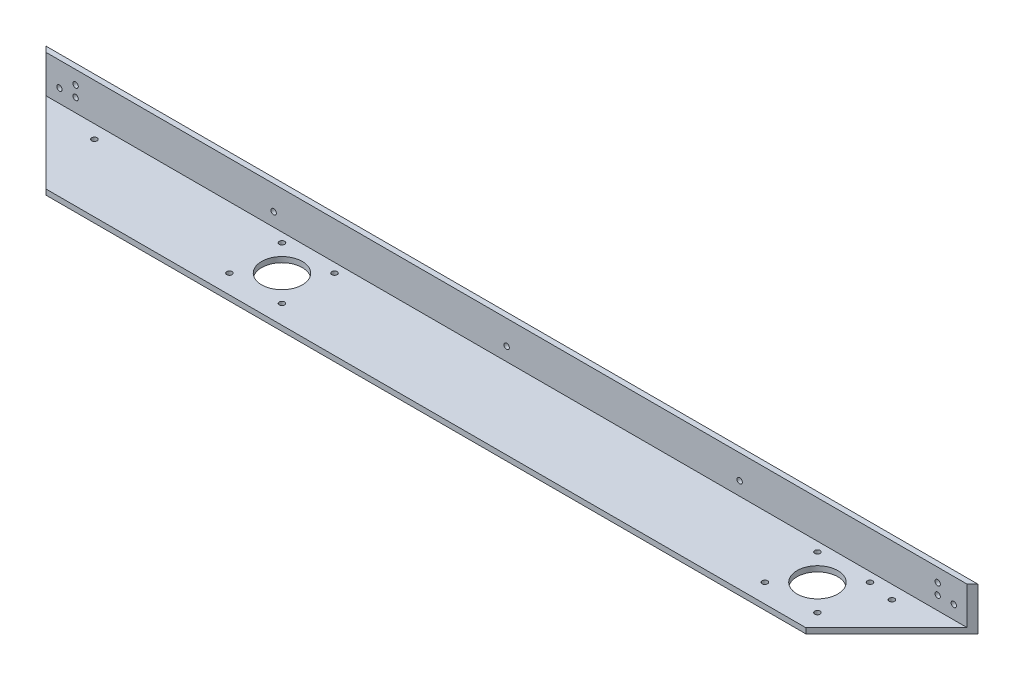
from build123d import *

# Parameters (mm, degrees)
BOSS_EXTRUDE1_DEPTH               = 550
CHAMFER7_SIZE                     = 50.8
CHAMFER8_SIZE                     = 50.8
BOTTHOMHOLES_SKETCH2_R            = 12
BOTTHOMHOLES_SKETCH2_R_2          = 1.5875
BOTTOMHOLES_CUT_EXTRUDE1_DEPTH    = 553.788015993
RIGHTSIDEHOLES_SKETCH3_R          = 1.5875
RIGHTSIDEHOLES_CUT_EXTRUDE2_DEPTH = 553.924768843


with BuildPart() as part:
    # Sketch1 → Boss-Extrude1 (new body)
    with BuildSketch(Plane(origin=(0, 0, 0), x_dir=(0, 0, -1), z_dir=(1, 0, 0))):
        Polygon((0, 0), (-50.8, 0), (-50.8, 3.175), (-3.175, 3.175), (-3.175, 25.4), (0, 25.4), align=None)
    extrude(amount=BOSS_EXTRUDE1_DEPTH)

    # Chamfer7
    chamfer7_edges = [part.edges().sort_by_distance(p)[0] for p in [
        (0, 1.5875, 50.8),
    ]]
    chamfer(chamfer7_edges, length=CHAMFER7_SIZE - 0.0001)  # a hair under: the kernel refuses the full size

    # Chamfer8
    chamfer8_edges = [part.edges().sort_by_distance(p)[0] for p in [
        (550, 1.5875, 50.8),
    ]]
    chamfer(chamfer8_edges, length=CHAMFER8_SIZE - 0.0001)  # a hair under: the kernel refuses the full size

    # BotthomHoles-Sketch2 → BottomHoles-Cut-Extrude1 (cut, through all)
    with BuildSketch(Plane(origin=(0, 3.175, 0), x_dir=(1, 0, 0), z_dir=(0, 1, 0))):
        with Locations(Location((479.425, -24.175, 0), (0, 0, 270))):
            Circle(BOTTHOMHOLES_SKETCH2_R)
        with Locations(Location((463.925, -8.675, 0), (0, 0, 270))):
            Circle(BOTTHOMHOLES_SKETCH2_R_2)
        with Locations(Location((494.925, -8.675, 0), (0, 0, 270))):
            Circle(BOTTHOMHOLES_SKETCH2_R_2)
        with Locations(Location((463.925, -39.675, 0), (0, 0, 270))):
            Circle(BOTTHOMHOLES_SKETCH2_R_2)
        with Locations(Location((494.925, -39.675, 0), (0, 0, 270))):
            Circle(BOTTHOMHOLES_SKETCH2_R_2)
        with Locations(Location((39.6875, -11.1125, 0), (0, 0, 270))):
            Circle(BOTTHOMHOLES_SKETCH2_R_2)
        with Locations(Location((510.3125, -11.1125, 0), (0, 0, 270))):
            Circle(BOTTHOMHOLES_SKETCH2_R_2)
        with Locations(Location((178.925, -39.675, 0), (0, 0, 270))):
            Circle(BOTTHOMHOLES_SKETCH2_R_2)
        with Locations(Location((147.925, -39.675, 0), (0, 0, 270))):
            Circle(BOTTHOMHOLES_SKETCH2_R_2)
        with Locations(Location((178.925, -8.675, 0), (0, 0, 270))):
            Circle(BOTTHOMHOLES_SKETCH2_R_2)
        with Locations(Location((147.925, -8.675, 0), (0, 0, 270))):
            Circle(BOTTHOMHOLES_SKETCH2_R_2)
        with Locations(Location((163.425, -24.175, 0), (0, 0, 270))):
            Circle(BOTTHOMHOLES_SKETCH2_R)
    extrude(amount=-BOTTOMHOLES_CUT_EXTRUDE1_DEPTH, mode=Mode.SUBTRACT)

    # RightSideHoles-Sketch3 → RightSideHoles-Cut-Extrude2 (cut, through all)
    with BuildSketch(Plane(origin=(0, 0, 0), x_dir=(-1, 0, 0), z_dir=(0, 0, -1))):
        with Locations(Location((-529.3625, 17.4625, 0), (0, 0, 90))):
            Circle(RIGHTSIDEHOLES_SKETCH3_R)
        with Locations(Location((-538.8875, 11.1125, 0), (0, 0, 90))):
            Circle(RIGHTSIDEHOLES_SKETCH3_R)
        with Locations(Location((-529.3625, 11.1125, 0), (0, 0, 90))):
            Circle(RIGHTSIDEHOLES_SKETCH3_R)
        with Locations(Location((-11.1125, 11.1125, 0), (0, 0, 90))):
            Circle(RIGHTSIDEHOLES_SKETCH3_R)
        with Locations(Location((-20.6375, 11.1125, 0), (0, 0, 90))):
            Circle(RIGHTSIDEHOLES_SKETCH3_R)
        with Locations(Location((-20.6375, 17.4625, 0), (0, 0, 90))):
            Circle(RIGHTSIDEHOLES_SKETCH3_R)
        with Locations(Location((-412.5, 11.1125, 0), (0, 0, 90))):
            Circle(RIGHTSIDEHOLES_SKETCH3_R)
        with Locations(Location((-275, 11.1125, 0), (0, 0, 90))):
            Circle(RIGHTSIDEHOLES_SKETCH3_R)
        with Locations(Location((-137.5, 11.1125, 0), (0, 0, 90))):
            Circle(RIGHTSIDEHOLES_SKETCH3_R)
    extrude(amount=-RIGHTSIDEHOLES_CUT_EXTRUDE2_DEPTH, mode=Mode.SUBTRACT)


solid = part.part
